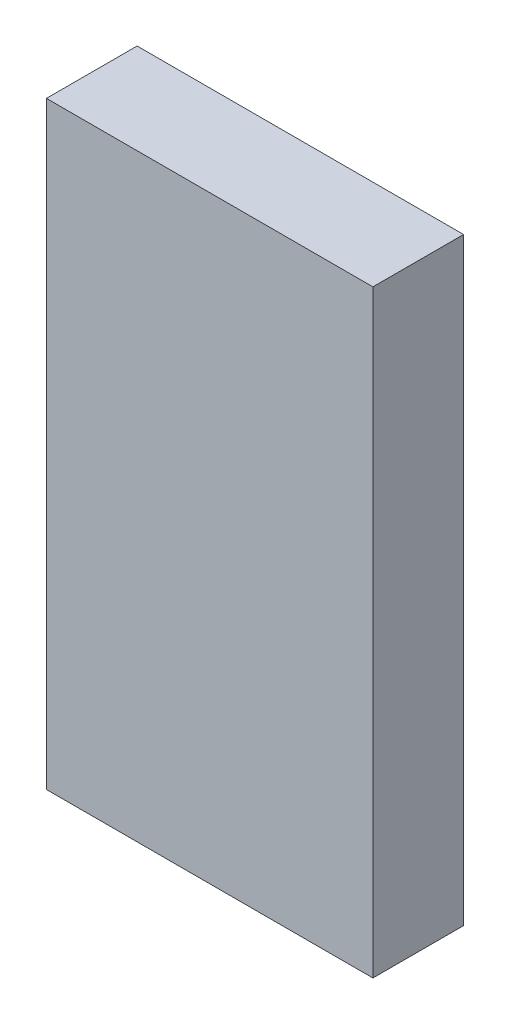
from build123d import *

# Parameters (mm, degrees)
SKETCH_1_W      = 36
SKETCH_1_H      = 66
EXTRUDE_1_DEPTH = 10


with BuildPart() as part:
    # 草图1 → 凸台-拉伸1 (new body)
    with BuildSketch(Plane.XY.offset(12)):
        with Locations((37, 33)):
            Rectangle(SKETCH_1_W, SKETCH_1_H)
    extrude(amount=-EXTRUDE_1_DEPTH)


solid = part.part
